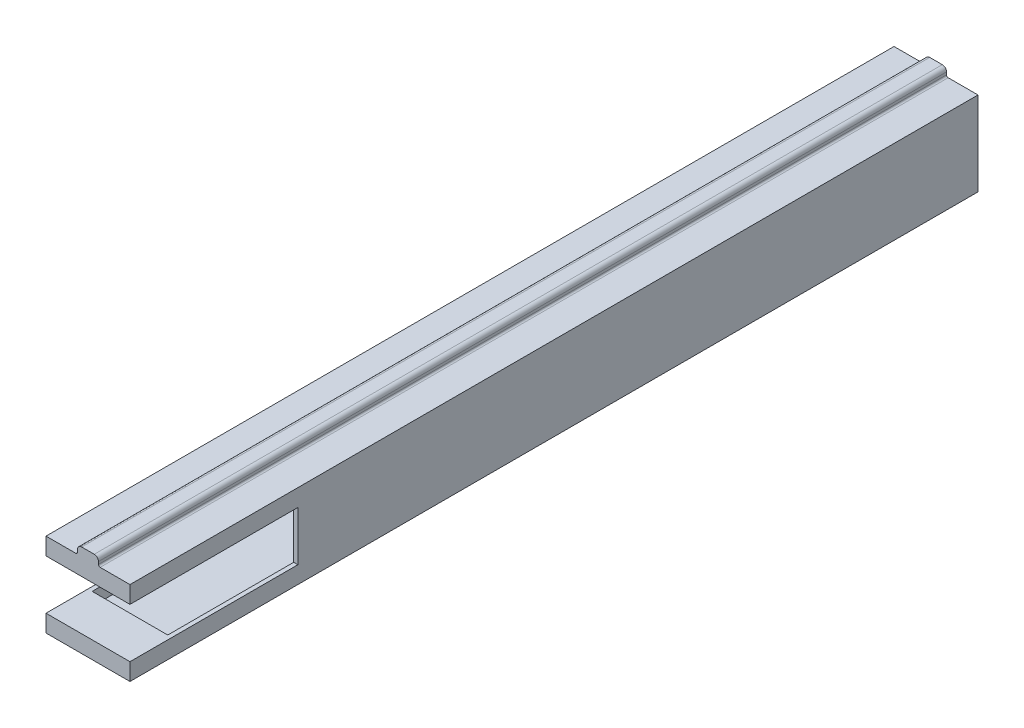
from build123d import *

# Parameters (mm, degrees)
SKETCH1_R           = 1.778
SKETCH1_R_2         = 6.35
BOSS_EXTRUDE1_DEPTH = 2.54
SKETCH2_W           = 22.86
SKETCH2_H           = 22.86
BOSS_EXTRUDE2_DEPTH = 254
FILLET1_R           = 1.27
FILLET2_R           = 0.508
SKETCH3_W           = 22.86
SKETCH3_H           = 12.7
BOSS_EXTRUDE3_DEPTH = 3.92938
SKETCH4_W           = 22.86
SKETCH4_H           = 12.7
BOSS_EXTRUDE4_DEPTH = 3.92938
SKETCH5_W           = 25.4
SKETCH5_H           = 15.00124
CUT_EXTRUDE1_DEPTH  = 50.8


with BuildPart() as part:
    # Sketch1 → Boss-Extrude1 (new body)
    with BuildSketch(Plane.XY):
        Polygon((-12.7, -12.7), (12.7, -12.7), (12.7, 12.7), (3.175, 12.7), (3.175, 15.24), (-3.175, 15.24), (-3.175, 12.7), (-12.7, 12.7), align=None)
        with Locations((0, -9.525)):
            Circle(SKETCH1_R, mode=Mode.SUBTRACT)
        with Locations((-8.248891971, 4.7625)):
            Circle(SKETCH1_R, mode=Mode.SUBTRACT)
        with Locations((8.248891971, 4.7625)):
            Circle(SKETCH1_R, mode=Mode.SUBTRACT)
        Circle(SKETCH1_R_2, mode=Mode.SUBTRACT)
    extrude(amount=BOSS_EXTRUDE1_DEPTH)

    # Sketch2 → Boss-Extrude2 (add)
    with BuildSketch(Plane.XY.offset(2.54)):
        Polygon((-12.7, -12.7), (12.7, -12.7), (12.7, 12.7), (3.175, 12.7), (3.175, 15.24), (-3.175, 15.24), (-3.175, 12.7), (-12.7, 12.7), align=None)
        Rectangle(SKETCH2_W, SKETCH2_H, mode=Mode.SUBTRACT)
    extrude(amount=BOSS_EXTRUDE2_DEPTH)

    # Fillet1
    fillet1_edges = [part.edges().sort_by_distance(p)[0] for p in [
        (3.175, 15.24, 128.27),
        (-3.175, 15.24, 128.27),
    ]]
    fillet(fillet1_edges, radius=FILLET1_R)

    # Fillet2
    fillet2_edges = [part.edges().sort_by_distance(p)[0] for p in [
        (3.175, 12.7, 128.27),
        (-3.175, 12.7, 128.27),
    ]]
    fillet(fillet2_edges, radius=FILLET2_R)

    # Sketch3 → Boss-Extrude3 (add)
    with BuildSketch(Plane.XZ.offset(-11.43)):
        with Locations((0, 250.19)):
            Rectangle(SKETCH3_W, SKETCH3_H)
    extrude(amount=BOSS_EXTRUDE3_DEPTH)

    # Sketch4 → Boss-Extrude4 (add)
    with BuildSketch(Plane(origin=(0, -11.43, 0), x_dir=(1, 0, 0), z_dir=(0, 1, 0))):
        with Locations((0, -250.19)):
            Rectangle(SKETCH4_W, SKETCH4_H)
    extrude(amount=BOSS_EXTRUDE4_DEPTH)

    # Sketch5 → Cut-Extrude1 (cut)
    with BuildSketch(Plane.XY.offset(256.54)):
        Rectangle(SKETCH5_W, SKETCH5_H)
    extrude(amount=-CUT_EXTRUDE1_DEPTH, mode=Mode.SUBTRACT)


solid = part.part
